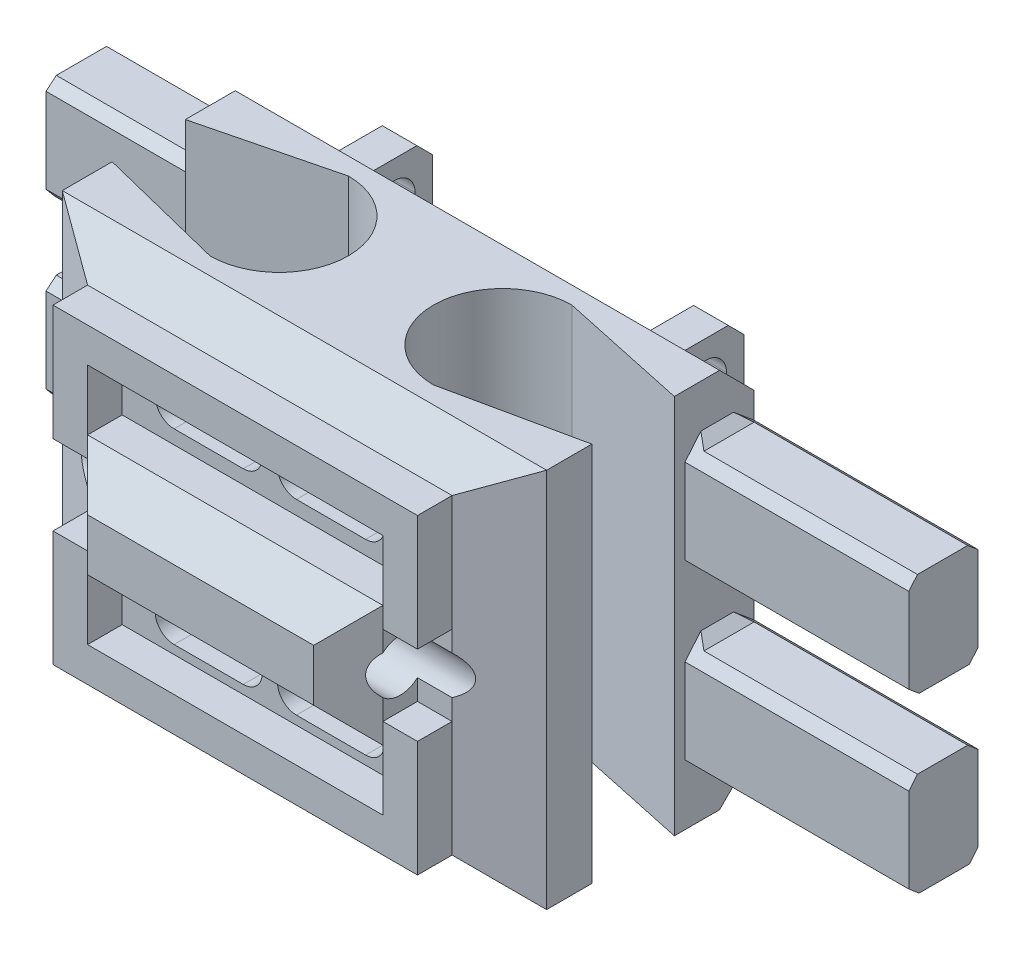
from build123d import *
from OCP.BRepFilletAPI import BRepFilletAPI_MakeChamfer

# Parameters (mm, degrees)
BASE_W                  = 14
BASE_H                  = 11
BOSS_EXTRUDE1_DEPTH     = 7
CHAMFER4_SIZE           = 1
CHAMFER5_SIZE           = 1
CHAMFER5_SIZE2          = 1.732050808
CHAMFER6_SIZE           = 1
SKETCH8_W               = 8.535898384
SKETCH8_H               = 3.5
BOSS_EXTRUDE5_DEPTH     = 2
CUT_EXTRUDE5_DEPTH      = 4.254422658
CUT_EXTRUDE5_DEPTH_BACK = 34.5
SKETCH9_R               = 0.75
CHAMFER9_SIZE           = 1
SKETCH13_W              = 5
SKETCH13_H              = 3.5
BOSS_EXTRUDE6_DEPTH     = 2
CHAMFER10_SIZE          = 1
CUT_EXTRUDE6_DEPTH      = 3
CUT_EXTRUDE6_DEPTH_BACK = 30
SKETCH14_R              = 0.75
SKETCH15_W              = 1
SKETCH15_H              = 3.75
BOSS_EXTRUDE7_DEPTH     = 2
CUT_EXTRUDE7_DEPTH      = 26
CHAMFER11_SIZE          = 0.3
CHAMFER12_SIZE          = 0.75
CUT_EXTRUDE8_DEPTH      = 11
SKETCH18_W              = 2
SKETCH18_H              = 3
BOSS_EXTRUDE8_DEPTH     = 6.47
CHAMFER13_SIZE          = 0.25
CHAMFER13_SIZE2         = 0.297938398
CHAMFER14_SIZE          = 0.25
CHAMFER14_SIZE2         = 0.297938398
SKETCH19_W              = 2
SKETCH19_H              = 3
BOSS_EXTRUDE9_DEPTH     = 4.47
CHAMFER15_SIZE          = 0.25
CHAMFER15_SIZE2         = 0.297938398
CHAMFER16_SIZE          = 0.25
CHAMFER16_SIZE2         = 0.297938398
SKETCH20_W              = 1
SKETCH20_H              = 2.345491503
SKETCH20_W_2            = 10.535898384
SKETCH20_H_2            = 1
BOSS_EXTRUDE10_DEPTH    = 1
CUT_EXTRUDE9_DEPTH      = 1


with BuildPart() as part:
    # Base → Boss-Extrude1 (new body)
    with BuildSketch(Plane.XY):
        with Locations((7, 5.5)):
            Rectangle(BASE_W, BASE_H)
    extrude(amount=BOSS_EXTRUDE1_DEPTH)

    # Chamfer4
    chamfer4_edges = [part.edges().sort_by_distance(p)[0] for p in [
        (7, 11, 7),
        (7, 0, 7),
    ]]
    chamfer(chamfer4_edges, length=CHAMFER4_SIZE)

    # Chamfer5: one chamfer whose edges measure the first distance from different faces: ONE call of the kernel's chamfer builder (chamfer() names one face for all edges)
    chamfer5_edges_1 = [part.edges().sort_by_distance(p)[0] for p in [
        (0, 5.5, 7),
    ]]
    chamfer5_side_1 = [part.faces().sort_by_distance(p)[0] for p in [
        (0, 5.5, 3.458333333),
    ]]
    chamfer5_edges_2 = [part.edges().sort_by_distance(p)[0] for p in [
        (14, 5.5, 7),
    ]]
    chamfer5_side_2 = [part.faces().sort_by_distance(p)[0] for p in [
        (14, 5.5, 3.458333333),
    ]]
    chamfer5 = BRepFilletAPI_MakeChamfer(part.part.solid().wrapped)
    for e in chamfer5_edges_1:
        chamfer5.Add(CHAMFER5_SIZE, CHAMFER5_SIZE2, e.wrapped, chamfer5_side_1[0].wrapped)  # the first distance lies on this face
    for e in chamfer5_edges_2:
        chamfer5.Add(CHAMFER5_SIZE, CHAMFER5_SIZE2, e.wrapped, chamfer5_side_2[0].wrapped)  # the first distance lies on this face
    add(Compound.cast(chamfer5.Shape()), mode=Mode.REPLACE)

    # Chamfer6
    chamfer6_edges = [part.edges().sort_by_distance(p)[0] for p in [
        (7, 11, 0),
        (7, 0, 0),
    ]]
    chamfer(chamfer6_edges, length=CHAMFER6_SIZE)

    # Sketch8 → Boss-Extrude5 (add)
    with BuildSketch(Plane.XY.offset(7)):
        with Locations((7, 5.5)):
            Rectangle(SKETCH8_W, SKETCH8_H)
    extrude(amount=BOSS_EXTRUDE5_DEPTH)

    # Sketch9 → Cut-Extrude5 (cut, two sides: drawn at the far end of the back side and taken through both)
    with BuildSketch(Plane(origin=(11.267949192, 0, 0), x_dir=(0, 0, -1), z_dir=(1, 0, 0)).offset(-CUT_EXTRUDE5_DEPTH_BACK)):
        with Locations(Location((-7.5, 5.5, 0), (0, 0, 311.810314896))):
            Circle(SKETCH9_R)
    extrude(amount=CUT_EXTRUDE5_DEPTH + CUT_EXTRUDE5_DEPTH_BACK, mode=Mode.SUBTRACT)

    # Chamfer9
    # the kernel refuses this chamfer: 1 mm, written as the material it takes off along each edge
    with BuildSketch(Plane(origin=(13.83963218, 3.75, 9), x_dir=(0, -0.027495876610586487, -0.9996219169112968), z_dir=(-1, 0, 0)), Plane(origin=(0.16036782, 7.25, 9), x_dir=(0, 0.027495876610586487, -0.9996219169112968), z_dir=(1, 0, 0))) as chamfer9_piece_1:
        Polygon((CHAMFER9_SIZE * 0.999621916911, -CHAMFER9_SIZE * 0.0274958766106), (-CHAMFER9_SIZE * 0.0274958766106, -CHAMFER9_SIZE * 0.999621916911), (0, 0), align=None)
    extrude(amount=13.679264361, mode=Mode.SUBTRACT)
    with BuildSketch(Plane(origin=(11.267949192, 9.821682988, 9), x_dir=(0.027495876610585623, 0, -0.9996219169112968), z_dir=(0, -1, 0)), Plane(origin=(2.732050808, 1.178317012, 9), x_dir=(-0.027495876610586487, 0, -0.9996219169112968), z_dir=(0, 1, 0))) as chamfer9_piece_2:
        Polygon((CHAMFER9_SIZE * 0.999621916911, -CHAMFER9_SIZE * 0.0274958766106), (-CHAMFER9_SIZE * 0.0274958766106, -CHAMFER9_SIZE * 0.999621916911), (0, 0), align=None)
    extrude(amount=8.643365976, mode=Mode.SUBTRACT)

    # Sketch13 → Boss-Extrude6 (add)
    with BuildSketch(Plane(origin=(0, 0, 0), x_dir=(-1, 0, 0), z_dir=(0, 0, -1))):
        with Locations((-3.5, 5.5)):
            Rectangle(SKETCH13_W, SKETCH13_H)
        with Locations((-10.5, 5.5)):
            Rectangle(SKETCH13_W, SKETCH13_H)
    extrude(amount=BOSS_EXTRUDE6_DEPTH)

    # Chamfer10
    chamfer10_edges = [part.edges().sort_by_distance(p)[0] for p in [
        (10.5, 7.25, -2),
        (13, 5.5, -2),
        (10.5, 3.75, -2),
        (8, 5.5, -2),
        (6, 5.5, -2),
        (3.5, 3.75, -2),
        (1, 5.5, -2),
        (3.5, 7.25, -2),
    ]]
    chamfer(chamfer10_edges, length=CHAMFER10_SIZE)

    # Sketch14 → Cut-Extrude6 (cut, two sides: drawn at the far end of the back side and taken through both)
    with BuildSketch(Plane.ZY.offset(-1).offset(-CUT_EXTRUDE6_DEPTH_BACK)):
        with Locations(Location((-0.5, 5.5, 0), (0, 0, 48.189685104))):
            Circle(SKETCH14_R)
    extrude(amount=CUT_EXTRUDE6_DEPTH + CUT_EXTRUDE6_DEPTH_BACK, mode=Mode.SUBTRACT)

    # Sketch15 → Boss-Extrude7 (add)
    with BuildSketch(Plane(origin=(0, 0, 0), x_dir=(-1, 0, 0), z_dir=(0, 0, -1))):
        with Locations((-11.5, 2.875)):
            Rectangle(SKETCH15_W, SKETCH15_H)
        with Locations((-11.5, 8.125)):
            Rectangle(SKETCH15_W, SKETCH15_H)
        with Locations((-2.5, 2.875)):
            Rectangle(SKETCH15_W, SKETCH15_H)
        with Locations((-2.5, 8.125)):
            Rectangle(SKETCH15_W, SKETCH15_H)
    extrude(amount=BOSS_EXTRUDE7_DEPTH)

    # Sketch16 → Cut-Extrude7 (cut)
    with BuildSketch(Plane(origin=(12, 0, 0), x_dir=(0, 0, -1), z_dir=(1, 0, 0))):
        with BuildLine():
            Line((1.2, 3.15), (1.2, 2.15))
            ThreePointArc((1.2, 2.15), (0.6, 1.55), (0, 2.15))
            Line((0, 2.15), (0, 3.15))
            ThreePointArc((0, 3.15), (0.6, 3.75), (1.2, 3.15))
        make_face()
        with BuildLine():
            Line((0, 7.85), (0, 8.85))
            ThreePointArc((0, 8.85), (0.6, 9.45), (1.2, 8.85))
            Line((1.2, 8.85), (1.2, 7.85))
            ThreePointArc((1.2, 7.85), (0.6, 7.25), (0, 7.85))
        make_face()
    extrude(amount=-CUT_EXTRUDE7_DEPTH, mode=Mode.SUBTRACT)

    # Chamfer11
    chamfer11_edges = [part.edges().sort_by_distance(p)[0] for p in [
        (12, 2.875, -2),
        (11, 2.875, -2),
        (2, 2.875, -2),
        (3, 2.875, -2),
        (12, 8.125, -2),
        (11, 8.125, -2),
        (2, 8.125, -2),
        (3, 8.125, -2),
    ]]
    chamfer(chamfer11_edges, length=CHAMFER11_SIZE)

    # Chamfer12
    chamfer12_edges = [part.edges().sort_by_distance(p)[0] for p in [
        (11.5, 1, -2),
        (11.5, 10, -2),
        (2.5, 10, -2),
        (2.5, 1, -2),
    ]]
    chamfer(chamfer12_edges, length=CHAMFER12_SIZE)

    # Tendon extrude → Cut-Extrude8 (cut)
    with BuildSketch(Plane.XZ):
        with BuildLine():
            Line((0, 4.5575), (0, 2.4425))
            Line((0, 2.4425), (3.77, 1.5))
            ThreePointArc((3.77, 1.5), (5.77, 3.5), (3.77, 5.5))
            Line((3.77, 5.5), (0, 4.5575))
        make_face()
        with BuildLine():
            Line((14, 2.307857143), (14, 4.692142857))
            Line((14, 4.692142857), (10.23, 5.5))
            ThreePointArc((10.23, 5.5), (8.23, 3.5), (10.23, 1.5))
            Line((10.23, 1.5), (14, 2.307857143))
        make_face()
    extrude(amount=-CUT_EXTRUDE8_DEPTH, mode=Mode.SUBTRACT)

    # Sketch18 → Boss-Extrude8 (add)
    with BuildSketch(Plane(origin=(14, 0, 0), x_dir=(0, 0, -1), z_dir=(1, 0, 0))):
        with Locations((-1, 8)):
            Rectangle(SKETCH18_W, SKETCH18_H)
        with Locations((-1, 3)):
            Rectangle(SKETCH18_W, SKETCH18_H)
    extrude(amount=BOSS_EXTRUDE8_DEPTH)

    # Chamfer13: one chamfer whose edges measure the first distance from different faces: ONE call of the kernel's chamfer builder (chamfer() names one face for all edges)
    chamfer13_edges_1 = [part.edges().sort_by_distance(p)[0] for p in [
        (17.235, 9.5, 2),
    ]]
    chamfer13_side_1 = [part.faces().sort_by_distance(p)[0] for p in [
        (17.235, 9.5, 1),
    ]]
    chamfer13_edges_2 = [part.edges().sort_by_distance(p)[0] for p in [
        (17.235, 6.5, 2),
    ]]
    chamfer13_side_2 = [part.faces().sort_by_distance(p)[0] for p in [
        (17.235, 8, 2),
    ]]
    chamfer13_edges_3 = [part.edges().sort_by_distance(p)[0] for p in [
        (17.235, 6.5, 0),
    ]]
    chamfer13_side_3 = [part.faces().sort_by_distance(p)[0] for p in [
        (17.235, 6.5, 1),
    ]]
    chamfer13_edges_4 = [part.edges().sort_by_distance(p)[0] for p in [
        (17.235, 9.5, 0),
    ]]
    chamfer13_side_4 = [part.faces().sort_by_distance(p)[0] for p in [
        (10.357244368, 8.252056428, 0),
    ]]
    chamfer13_edges_5 = [part.edges().sort_by_distance(p)[0] for p in [
        (17.235, 4.5, 2),
    ]]
    chamfer13_side_5 = [part.faces().sort_by_distance(p)[0] for p in [
        (17.235, 4.5, 1),
    ]]
    chamfer13_edges_6 = [part.edges().sort_by_distance(p)[0] for p in [
        (17.235, 1.5, 2),
    ]]
    chamfer13_side_6 = [part.faces().sort_by_distance(p)[0] for p in [
        (17.235, 3, 2),
    ]]
    chamfer13_edges_7 = [part.edges().sort_by_distance(p)[0] for p in [
        (17.235, 1.5, 0),
    ]]
    chamfer13_side_7 = [part.faces().sort_by_distance(p)[0] for p in [
        (17.235, 1.5, 1),
    ]]
    chamfer13_edges_8 = [part.edges().sort_by_distance(p)[0] for p in [
        (17.235, 4.5, 0),
    ]]
    chamfer13_side_8 = [part.faces().sort_by_distance(p)[0] for p in [
        (10.357244368, 2.747943572, 0),
    ]]
    chamfer13 = BRepFilletAPI_MakeChamfer(part.part.solid().wrapped)
    for e in chamfer13_edges_1:
        chamfer13.Add(CHAMFER13_SIZE, CHAMFER13_SIZE2, e.wrapped, chamfer13_side_1[0].wrapped)  # the first distance lies on this face
    for e in chamfer13_edges_2:
        chamfer13.Add(CHAMFER13_SIZE, CHAMFER13_SIZE2, e.wrapped, chamfer13_side_2[0].wrapped)  # the first distance lies on this face
    for e in chamfer13_edges_3:
        chamfer13.Add(CHAMFER13_SIZE, CHAMFER13_SIZE2, e.wrapped, chamfer13_side_3[0].wrapped)  # the first distance lies on this face
    for e in chamfer13_edges_4:
        chamfer13.Add(CHAMFER13_SIZE, CHAMFER13_SIZE2, e.wrapped, chamfer13_side_4[0].wrapped)  # the first distance lies on this face
    for e in chamfer13_edges_5:
        chamfer13.Add(CHAMFER13_SIZE, CHAMFER13_SIZE2, e.wrapped, chamfer13_side_5[0].wrapped)  # the first distance lies on this face
    for e in chamfer13_edges_6:
        chamfer13.Add(CHAMFER13_SIZE, CHAMFER13_SIZE2, e.wrapped, chamfer13_side_6[0].wrapped)  # the first distance lies on this face
    for e in chamfer13_edges_7:
        chamfer13.Add(CHAMFER13_SIZE, CHAMFER13_SIZE2, e.wrapped, chamfer13_side_7[0].wrapped)  # the first distance lies on this face
    for e in chamfer13_edges_8:
        chamfer13.Add(CHAMFER13_SIZE, CHAMFER13_SIZE2, e.wrapped, chamfer13_side_8[0].wrapped)  # the first distance lies on this face
    add(Compound.cast(chamfer13.Shape()), mode=Mode.REPLACE)

    # Chamfer14
    chamfer14_edges = [part.edges().sort_by_distance(p)[0] for p in [
        (14, 1.5, 0.976030801),
        (14, 4.5, 1.023969199),
        (14, 6.5, 0.976030801),
        (14, 9.5, 1.023969199),
    ]]
    chamfer14_side = [part.faces().sort_by_distance(p)[0] for p in [
        (14, 5.5, 1.3801438),
    ]]
    chamfer(chamfer14_edges, length=CHAMFER14_SIZE, length2=CHAMFER14_SIZE2, reference=chamfer14_side[0])

    # Sketch19 → Boss-Extrude9 (add)
    with BuildSketch(Plane.ZY):
        with Locations((1, 3)):
            Rectangle(SKETCH19_W, SKETCH19_H)
        with Locations((1, 8)):
            Rectangle(SKETCH19_W, SKETCH19_H)
    extrude(amount=BOSS_EXTRUDE9_DEPTH)

    # Chamfer15: one chamfer whose edges measure the first distance from different faces: ONE call of the kernel's chamfer builder (chamfer() names one face for all edges)
    chamfer15_edges_1 = [part.edges().sort_by_distance(p)[0] for p in [
        (-2.235, 4.5, 0),
    ]]
    chamfer15_side_1 = [part.faces().sort_by_distance(p)[0] for p in [
        (-2.235, 4.5, 1),
    ]]
    chamfer15_edges_2 = [part.edges().sort_by_distance(p)[0] for p in [
        (-2.235, 1.5, 0),
    ]]
    chamfer15_side_2 = [part.faces().sort_by_distance(p)[0] for p in [
        (7.558168582, 2.789467536, 0),
    ]]
    chamfer15_edges_3 = [part.edges().sort_by_distance(p)[0] for p in [
        (-2.235, 1.5, 2),
    ]]
    chamfer15_side_3 = [part.faces().sort_by_distance(p)[0] for p in [
        (-2.235, 1.5, 1),
    ]]
    chamfer15_edges_4 = [part.edges().sort_by_distance(p)[0] for p in [
        (-2.235, 4.5, 2),
    ]]
    chamfer15_side_4 = [part.faces().sort_by_distance(p)[0] for p in [
        (-2.235, 3, 2),
    ]]
    chamfer15_edges_5 = [part.edges().sort_by_distance(p)[0] for p in [
        (-2.235, 6.5, 0),
    ]]
    chamfer15_side_5 = [part.faces().sort_by_distance(p)[0] for p in [
        (7.558168582, 8.22154852, 0),
    ]]
    chamfer15_edges_6 = [part.edges().sort_by_distance(p)[0] for p in [
        (-2.235, 6.5, 2),
    ]]
    chamfer15_side_6 = [part.faces().sort_by_distance(p)[0] for p in [
        (-2.235, 6.5, 1),
    ]]
    chamfer15_edges_7 = [part.edges().sort_by_distance(p)[0] for p in [
        (-2.235, 9.5, 2),
    ]]
    chamfer15_side_7 = [part.faces().sort_by_distance(p)[0] for p in [
        (-2.235, 8, 2),
    ]]
    chamfer15_edges_8 = [part.edges().sort_by_distance(p)[0] for p in [
        (-2.235, 9.5, 0),
    ]]
    chamfer15_side_8 = [part.faces().sort_by_distance(p)[0] for p in [
        (-2.235, 9.5, 1),
    ]]
    chamfer15 = BRepFilletAPI_MakeChamfer(part.part.solid().wrapped)
    for e in chamfer15_edges_1:
        chamfer15.Add(CHAMFER15_SIZE, CHAMFER15_SIZE2, e.wrapped, chamfer15_side_1[0].wrapped)  # the first distance lies on this face
    for e in chamfer15_edges_2:
        chamfer15.Add(CHAMFER15_SIZE, CHAMFER15_SIZE2, e.wrapped, chamfer15_side_2[0].wrapped)  # the first distance lies on this face
    for e in chamfer15_edges_3:
        chamfer15.Add(CHAMFER15_SIZE, CHAMFER15_SIZE2, e.wrapped, chamfer15_side_3[0].wrapped)  # the first distance lies on this face
    for e in chamfer15_edges_4:
        chamfer15.Add(CHAMFER15_SIZE, CHAMFER15_SIZE2, e.wrapped, chamfer15_side_4[0].wrapped)  # the first distance lies on this face
    for e in chamfer15_edges_5:
        chamfer15.Add(CHAMFER15_SIZE, CHAMFER15_SIZE2, e.wrapped, chamfer15_side_5[0].wrapped)  # the first distance lies on this face
    for e in chamfer15_edges_6:
        chamfer15.Add(CHAMFER15_SIZE, CHAMFER15_SIZE2, e.wrapped, chamfer15_side_6[0].wrapped)  # the first distance lies on this face
    for e in chamfer15_edges_7:
        chamfer15.Add(CHAMFER15_SIZE, CHAMFER15_SIZE2, e.wrapped, chamfer15_side_7[0].wrapped)  # the first distance lies on this face
    for e in chamfer15_edges_8:
        chamfer15.Add(CHAMFER15_SIZE, CHAMFER15_SIZE2, e.wrapped, chamfer15_side_8[0].wrapped)  # the first distance lies on this face
    add(Compound.cast(chamfer15.Shape()), mode=Mode.REPLACE)

    # Chamfer16
    chamfer16_edges = [part.edges().sort_by_distance(p)[0] for p in [
        (0, 1.5, 1.023969199),
        (0, 4.5, 0.976030801),
        (0, 9.5, 0.976030801),
        (0, 6.5, 1.023969199),
    ]]
    chamfer16_side = [part.faces().sort_by_distance(p)[0] for p in [
        (0, 5.5, 1.485621458),
    ]]
    chamfer(chamfer16_edges, length=CHAMFER16_SIZE, length2=CHAMFER16_SIZE2, reference=chamfer16_side[0])

    # Sketch20 → Boss-Extrude10 (add)
    with BuildSketch(Plane.XY.offset(7)):
        Polygon((2.732050808, 9), (1.732050808, 9), (1.732050808, 6.654508497), (2.732050808, 6.654508497), (2.732050808, 7.25), align=None)
        Polygon((12.267949192, 10), (1.732050808, 10), (1.732050808, 9), (2.732050808, 9), (11.267949192, 9), (12.267949192, 9), align=None)
        Polygon((12.267949192, 6.654508497), (12.267949192, 9), (11.267949192, 9), (11.267949192, 7.25), (11.267949192, 6.654508497), align=None)
        with Locations((11.767949192, 3.172745751)):
            Rectangle(SKETCH20_W, SKETCH20_H)
        with Locations((7, 1.5)):
            Rectangle(SKETCH20_W_2, SKETCH20_H_2)
        with Locations((2.232050808, 3.172745751)):
            Rectangle(SKETCH20_W, SKETCH20_H)
    extrude(amount=BOSS_EXTRUDE10_DEPTH)

    # Sketch21 → Cut-Extrude9 (cut)
    with BuildSketch(Plane.XY.offset(7)):
        with BuildLine():
            Line((4.232050808, 8.746865984), (6.232050808, 8.746865984))
            ThreePointArc((6.232050808, 8.746865984), (6.778916791, 8.2), (6.232050808, 7.653134016))
            Line((6.232050808, 7.653134016), (4.232050808, 7.653134016))
            ThreePointArc((4.232050808, 7.653134016), (3.685184824, 8.2), (4.232050808, 8.746865984))
        make_face()
        with BuildLine():
            Line((7.767949192, 8.746865984), (9.767949192, 8.746865984))
            ThreePointArc((9.767949192, 8.746865984), (10.314815176, 8.2), (9.767949192, 7.653134016))
            Line((9.767949192, 7.653134016), (7.767949192, 7.653134016))
            ThreePointArc((7.767949192, 7.653134016), (7.221083209, 8.2), (7.767949192, 8.746865984))
        make_face()
        with BuildLine():
            Line((7.767949192, 3.346865984), (9.767949192, 3.346865984))
            ThreePointArc((9.767949192, 3.346865984), (10.314815176, 2.8), (9.767949192, 2.253134016))
            Line((9.767949192, 2.253134016), (7.767949192, 2.253134016))
            ThreePointArc((7.767949192, 2.253134016), (7.221083209, 2.8), (7.767949192, 3.346865984))
        make_face()
        with BuildLine():
            Line((6.232050808, 2.253134016), (4.232050808, 2.253134016))
            ThreePointArc((4.232050808, 2.253134016), (3.685184824, 2.8), (4.232050808, 3.346865984))
            Line((4.232050808, 3.346865984), (6.232050808, 3.346865984))
            ThreePointArc((6.232050808, 3.346865984), (6.778916791, 2.8), (6.232050808, 2.253134016))
        make_face()
    extrude(amount=-CUT_EXTRUDE9_DEPTH, mode=Mode.SUBTRACT)


solid = part.part
